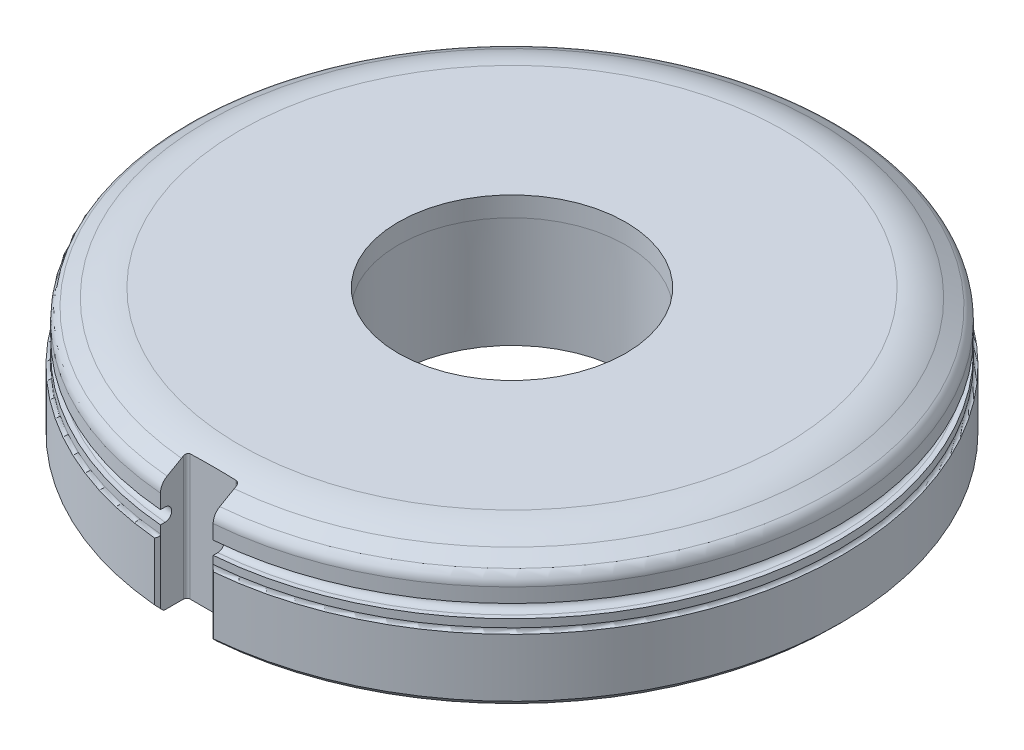
from build123d import *

# Parameters (mm, degrees)
CORTE_EXTRUS_O_CHAVETA_REACH = 75.485
CHANFRO1_SIZE                = 0.464340997
CHANFRO1_SIZE_2              = 0.5
ESBO_O_PERFIL_R              = 17.25
VIDA_DEPTH                   = 3
ESBO_O1_R                    = 17.25
CORTE_EXTRUS_O2_DEPTH        = 73.725511503
CORTE_EXTRUS_O2_DRAFT        = 1


with BuildPart() as part:
    # Revolução_Semi-Acabado: read off the stored shape, not the designer's step
    # Revolução_Semi-Acabado outline → Revolução_Semi-Acabado (revolve)
    with BuildSketch(Plane.XY):
        with BuildLine():
            Line((49, 0), (50, 1))
            Line((50, 1), (50, 9.8))
            ThreePointArc((50, 9.8), (49.646446609, 9.946446609), (49.5, 10.3))
            Line((49.5, 10.3), (49.5, 11.5))
            Line((49.5, 11.5), (48.8, 11.5))
            ThreePointArc((48.8, 11.5), (47.8, 12.5), (48.8, 13.5))
            Line((48.8, 13.5), (49.5, 13.5))
            Line((49.5, 13.5), (49.5, 15.669872981))
            ThreePointArc((49.5, 15.669872981), (49.232050808, 16.669872981), (48.5, 17.401923789))
            Line((48.5, 17.401923789), (46.320508076, 18.660254038))
            ThreePointArc((46.320508076, 18.660254038), (43.908698527, 19.659258263), (41.320508076, 20))
            Line((41.320508076, 20), (0, 20))
            Line((0, 20), (0, 0))
            Line((0, 0), (49, 0))
        make_face()
    revolve(axis=Axis((0, 0, 0), (0, 1, 0)))

    # Esboço_Chaveta → Corte-extrusão_Chaveta (cut, up to next)
    with BuildSketch(Plane(origin=(0, 20, 0), x_dir=(1, 0, 0), z_dir=(0, 1, 0)), mode=Mode.PRIVATE) as corte_extrus_o_chaveta_sk1:
        with BuildLine():
            Line((-4, -49.839743178), (-4, -45.839743178))
            ThreePointArc((-4, -45.839743178), (-3.853553391, -45.486189787), (-3.5, -45.339743178))
            Line((-3.5, -45.339743178), (3.5, -45.339743178))
            ThreePointArc((3.5, -45.339743178), (3.853553391, -45.486189787), (4, -45.839743178))
            Line((4, -45.839743178), (4, -49.839743178))
            ThreePointArc((4, -49.839743178), (0, -50), (-4, -49.839743178))
        make_face()
    corte_extrus_o_chaveta_tool1 = extrude(corte_extrus_o_chaveta_sk1.sketch, amount=-CORTE_EXTRUS_O_CHAVETA_REACH, mode=Mode.PRIVATE) & part.part
    add(corte_extrus_o_chaveta_tool1.solids().sort_by_distance((0, 20, 47.649827))[0], mode=Mode.SUBTRACT)

    # Chanfro1
    # the kernel refuses this chamfer: 0.5, 0.464340997 mm, written as the material it takes off along each edge
    with BuildSketch(Plane(origin=(4, 11.079499398, 49.839743178), x_dir=(0, 0, -1), z_dir=(0, -1, 0))) as chanfro1_piece_1:
        with BuildLine():
            Line((CHANFRO1_SIZE * 0.999999998989, 0), (0.042269405, 0.495731967))
            ThreePointArc((0.042269405, 0.495731967), (0.02111626, 0.25492797), (0, 0))
            Line((0, 0), (CHANFRO1_SIZE * 0.999999998989, 0))
        make_face()
    extrude(amount=11.358998797, mode=Mode.SUBTRACT)
    with BuildSketch(Plane(origin=(-4, 11.085841494, 49.839743178), x_dir=(0, 0, -1), z_dir=(0, -1, 0))) as chanfro1_piece_2:
        with BuildLine():
            Line((CHANFRO1_SIZE_2, 0), (0.039133999, -0.460866001))
            ThreePointArc((0.039133999, -0.460866001), (0.019579943, -0.236901616), (0, 0))
            Line((0, 0), (CHANFRO1_SIZE_2, 0))
        make_face()
    extrude(amount=11.371682988, mode=Mode.SUBTRACT)

    # Esboço_Perfil → VIDA (cut)
    with BuildSketch(Plane(origin=(0, 20, 0), x_dir=(1, 0, 0), z_dir=(0, 1, 0))):
        with Locations(Location((0, 0, 0), (0, 0, 180))):
            Circle(ESBO_O_PERFIL_R)
    extrude(amount=-VIDA_DEPTH, mode=Mode.SUBTRACT)


with BuildPart() as corte_extrus_o2_tool:
    # Esboço1 → Corte-extrusão2 (with draft: the straight prism first)
    with BuildSketch(Plane(origin=(0, 17, 0), x_dir=(1, 0, 0), z_dir=(0, 1, 0))):
        with Locations(Location((0, 0, 0), (0, 0, 180))):
            Circle(ESBO_O1_R)
    extrude(amount=-CORTE_EXTRUS_O2_DEPTH)
    # Corte-extrusão2: the draft: its side faces are tilted about the plane it starts from
    corte_extrus_o2_sides = [corte_extrus_o2_tool.faces().sort_by_distance(p)[0] for p in [
        (17.25, -19.862755752, 0),
    ]]
    draft(corte_extrus_o2_sides, Plane(origin=(0, 17, 0), x_dir=(1, 0, 0), z_dir=(0, 1, 0)), CORTE_EXTRUS_O2_DRAFT)


with BuildPart() as part_1:
    add(part.part)

    # Corte-extrusão2: cut by corte_extrus_o2_tool
    add(corte_extrus_o2_tool.part, mode=Mode.SUBTRACT)


solid = part_1.part
